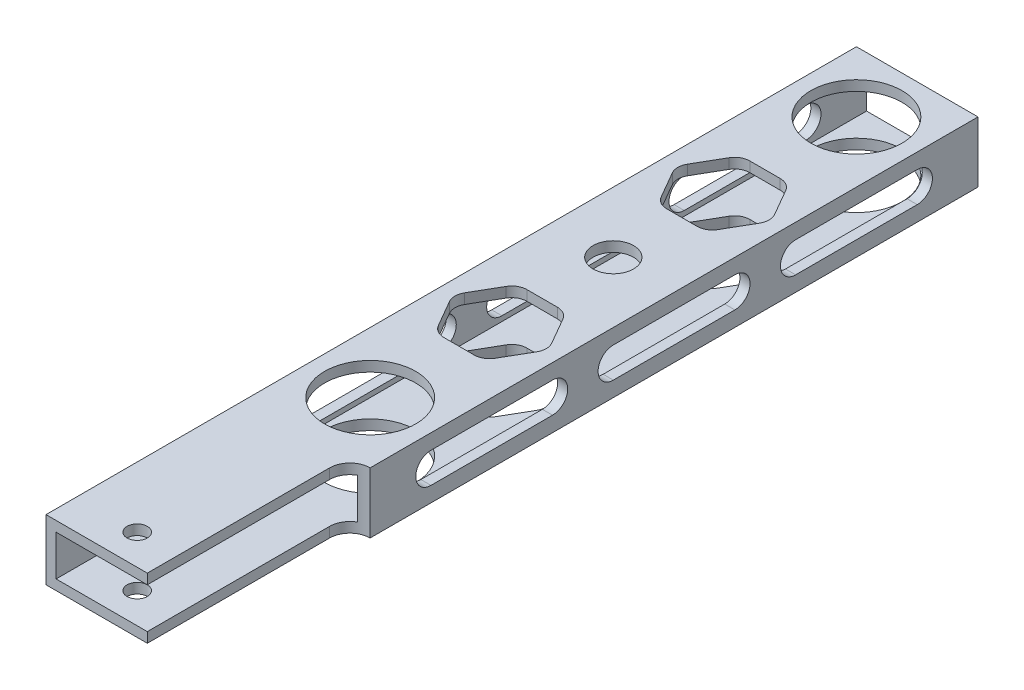
from build123d import *

# Parameters (mm, degrees)
SKETCH1_W           = 38.1
SKETCH1_H           = 19.05
SKETCH1_W_2         = 31.75
SKETCH1_H_2         = 12.7
BOSS_EXTRUDE1_DEPTH = 254
SKETCH2_R           = 14.2875
CUT_EXTRUDE1_DEPTH  = 258.547107342
SKETCH3_R           = 3.175
CUT_EXTRUDE2_DEPTH  = 258.547107342
CUT_EXTRUDE3_DEPTH  = 258.547107342
SKETCH5_R           = 2.667
CUT_EXTRUDE4_DEPTH  = 258.547107342
CUT_EXTRUDE6_DEPTH  = 258.547107342
CUT_EXTRUDE7_DEPTH  = 258.547107342
CUT_EXTRUDE8_REACH  = 259.547
SKETCH6_R           = 6.35


with BuildPart() as part:
    # Sketch1 → Boss-Extrude1 (new body)
    with BuildSketch(Plane.XY):
        with Locations((19.05, 9.525)):
            Rectangle(SKETCH1_W, SKETCH1_H)
        with Locations((19.05, 9.525)):
            Rectangle(SKETCH1_W_2, SKETCH1_H_2, mode=Mode.SUBTRACT)
    extrude(amount=BOSS_EXTRUDE1_DEPTH)

    # Sketch2 → Cut-Extrude1 (cut, through all)
    with BuildSketch(Plane(origin=(0, 19.05, 0), x_dir=(1, 0, 0), z_dir=(0, 1, 0))):
        with Locations((19.05, -19.05)):
            Circle(SKETCH2_R)
        with Locations((19.05, -171.45)):
            Circle(SKETCH2_R)
    extrude(amount=-CUT_EXTRUDE1_DEPTH, mode=Mode.SUBTRACT)

    # Sketch3 → Cut-Extrude2 (cut, through all)
    with BuildSketch(Plane(origin=(0, 19.05, 0), x_dir=(1, 0, 0), z_dir=(0, 1, 0))):
        with Locations((19.05, -244.475)):
            Circle(SKETCH3_R)
    extrude(amount=-CUT_EXTRUDE2_DEPTH, mode=Mode.SUBTRACT)

    # Sketch4 → Cut-Extrude3 (cut, through all)
    with BuildSketch(Plane(origin=(0, 19.05, 0), x_dir=(1, 0, 0), z_dir=(0, 1, 0))):
        with BuildLine():
            Line((31.75, -254), (31.75, -196.85))
            ThreePointArc((31.75, -196.85), (33.609871939, -192.359871939), (38.1, -190.5))
            Line((38.1, -190.5), (38.1, -254))
            Line((38.1, -254), (31.75, -254))
        make_face()
    extrude(amount=-CUT_EXTRUDE3_DEPTH, mode=Mode.SUBTRACT)

    # Sketch5 → Cut-Extrude4 (cut, through all)
    with BuildSketch(Plane.XZ):
        with Locations((19.05, 95.25)):
            Circle(SKETCH5_R)
    extrude(amount=-CUT_EXTRUDE4_DEPTH, mode=Mode.SUBTRACT)

    # Sketch7 → Cut-Extrude6 (cut, through all)
    with BuildSketch(Plane.ZY):
        with BuildLine():
            Line((19.05, 14.2875), (57.15, 14.2875))
            ThreePointArc((57.15, 14.2875), (61.9125, 9.525), (57.15, 4.7625))
            Line((57.15, 4.7625), (19.05, 4.7625))
            ThreePointArc((19.05, 4.7625), (14.2875, 9.525), (19.05, 14.2875))
        make_face()
        with BuildLine():
            Line((76.2, 14.2875), (114.3, 14.2875))
            ThreePointArc((114.3, 14.2875), (119.0625, 9.525), (114.3, 4.7625))
            Line((114.3, 4.7625), (76.2, 4.7625))
            ThreePointArc((76.2, 4.7625), (71.4375, 9.525), (76.2, 14.2875))
        make_face()
        with BuildLine():
            Line((133.35, 14.2875), (171.45, 14.2875))
            ThreePointArc((171.45, 14.2875), (176.2125, 9.525), (171.45, 4.7625))
            Line((171.45, 4.7625), (133.35, 4.7625))
            ThreePointArc((133.35, 4.7625), (128.5875, 9.525), (133.35, 14.2875))
        make_face()
        with BuildLine():
            Line((196.85, 14.2875), (234.95, 14.2875))
            ThreePointArc((234.95, 14.2875), (239.7125, 9.525), (234.95, 4.7625))
            Line((234.95, 4.7625), (196.85, 4.7625))
            ThreePointArc((196.85, 4.7625), (192.0875, 9.525), (196.85, 14.2875))
        make_face()
    extrude(amount=-CUT_EXTRUDE6_DEPTH, mode=Mode.SUBTRACT)

    # Sketch8 → Cut-Extrude7 (cut, through all)
    with BuildSketch(Plane(origin=(0, 19.05, 0), x_dir=(1, 0, 0), z_dir=(0, 1, 0))):
        with BuildLine():
            Line((5.400554014, -63.102041579), (10.163054014, -71.35093355))
            ThreePointArc((10.163054014, -71.35093355), (11.90625, -73.094129535), (14.2875, -73.73218355))
            Line((14.2875, -73.73218355), (23.8125, -73.73218355))
            ThreePointArc((23.8125, -73.73218355), (26.19375, -73.094129535), (27.936945986, -71.35093355))
            Line((27.936945986, -71.35093355), (32.699445986, -63.102041579))
            ThreePointArc((32.699445986, -63.102041579), (33.3375, -60.720791579), (32.699445986, -58.339541579))
            Line((32.699445986, -58.339541579), (27.936945986, -50.090649608))
            ThreePointArc((27.936945986, -50.090649608), (26.19375, -48.347453622), (23.8125, -47.709399608))
            Line((23.8125, -47.709399608), (14.2875, -47.709399608))
            ThreePointArc((14.2875, -47.709399608), (11.90625, -48.347453622), (10.163054014, -50.090649608))
            Line((10.163054014, -50.090649608), (5.400554014, -58.339541579))
            ThreePointArc((5.400554014, -58.339541579), (4.7625, -60.720791579), (5.400554014, -63.102041579))
        make_face()
        with BuildLine():
            Line((5.400554014, -132.952041579), (10.163054014, -141.20093355))
            ThreePointArc((10.163054014, -141.20093355), (11.90625, -142.944129535), (14.2875, -143.58218355))
            Line((14.2875, -143.58218355), (23.8125, -143.58218355))
            ThreePointArc((23.8125, -143.58218355), (26.19375, -142.944129535), (27.936945986, -141.20093355))
            Line((27.936945986, -141.20093355), (32.699445986, -132.952041579))
            ThreePointArc((32.699445986, -132.952041579), (33.3375, -130.570791579), (32.699445986, -128.189541579))
            Line((32.699445986, -128.189541579), (27.936945986, -119.940649608))
            ThreePointArc((27.936945986, -119.940649608), (26.19375, -118.197453622), (23.8125, -117.559399608))
            Line((23.8125, -117.559399608), (14.2875, -117.559399608))
            ThreePointArc((14.2875, -117.559399608), (11.90625, -118.197453622), (10.163054014, -119.940649608))
            Line((10.163054014, -119.940649608), (5.400554014, -128.189541579))
            ThreePointArc((5.400554014, -128.189541579), (4.7625, -130.570791579), (5.400554014, -132.952041579))
        make_face()
    extrude(amount=-CUT_EXTRUDE7_DEPTH, mode=Mode.SUBTRACT)

    # Sketch6 → Cut-Extrude8 (cut, up to next)
    with BuildSketch(Plane(origin=(0, 19.05, 0), x_dir=(1, 0, 0), z_dir=(0, 1, 0)), mode=Mode.PRIVATE) as cut_extrude8_sk1:
        with Locations((19.05, -95.25)):
            Circle(SKETCH6_R)
    cut_extrude8_tool1 = extrude(cut_extrude8_sk1.sketch, amount=-CUT_EXTRUDE8_REACH, mode=Mode.PRIVATE) & part.part
    add(cut_extrude8_tool1.solids().sort_by_distance((19.05, 19.05, 95.25))[0], mode=Mode.SUBTRACT)


solid = part.part
